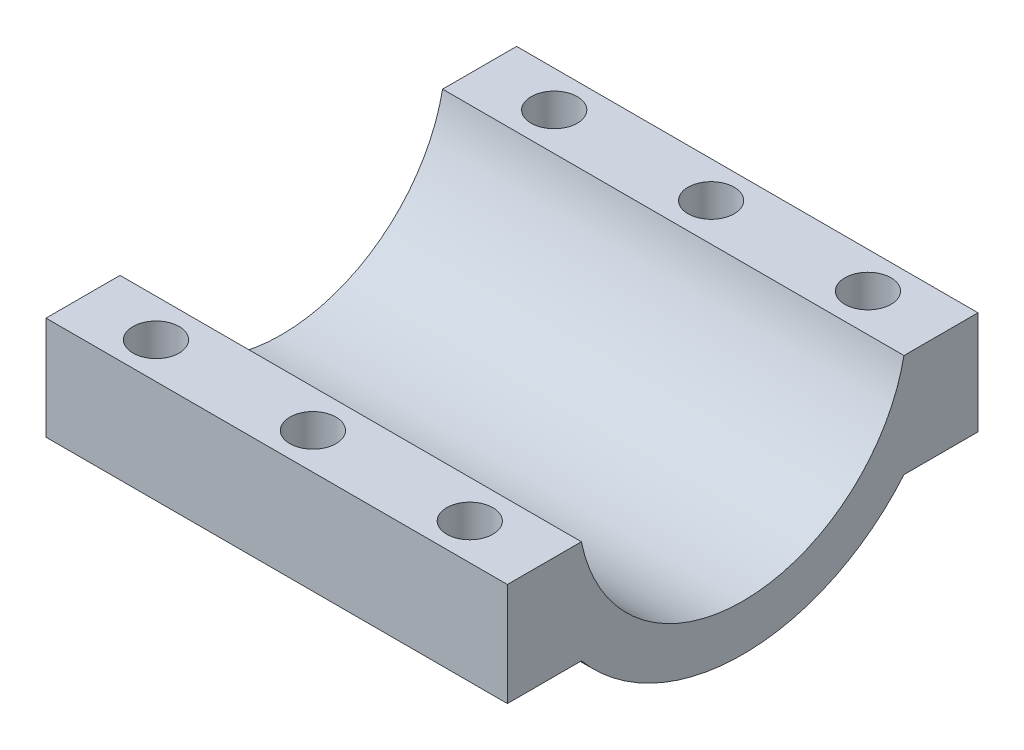
from build123d import *

# Parameters (mm, degrees)
SKETCH1_W           = 50
SKETCH1_H           = 51
SKETCH1_R           = 2.5
BOSS_EXTRUDE1_DEPTH = 19.325
SKETCH2_R           = 17.825
CUT_EXTRUDE1_DEPTH  = 60.36080883
SKETCH3_R           = 6
CUT_EXTRUDE2_DEPTH  = 10


with BuildPart() as part:
    # Sketch1 → Boss-Extrude1 (new body)
    with BuildSketch(Plane(origin=(0, 0, 0), x_dir=(1, 0, 0), z_dir=(0, 1, 0))):
        Rectangle(SKETCH1_W, SKETCH1_H)
        with Locations((-17, 21.575)):
            Circle(SKETCH1_R, mode=Mode.SUBTRACT)
        with Locations((17, 21.575)):
            Circle(SKETCH1_R, mode=Mode.SUBTRACT)
        with Locations((17, -21.575)):
            Circle(SKETCH1_R, mode=Mode.SUBTRACT)
        with Locations((-17, -21.575)):
            Circle(SKETCH1_R, mode=Mode.SUBTRACT)
        with Locations((0, 21.575)):
            Circle(SKETCH1_R, mode=Mode.SUBTRACT)
        with Locations((0, -21.575)):
            Circle(SKETCH1_R, mode=Mode.SUBTRACT)
    extrude(amount=BOSS_EXTRUDE1_DEPTH)

    # Sketch2 → Cut-Extrude1 (cut, through all)
    with BuildSketch(Plane(origin=(25, 0, 0), x_dir=(0, 0, -1), z_dir=(1, 0, 0))):
        with Locations((0, 22.825)):
            Circle(SKETCH2_R)
        with BuildLine():
            Line((-17.478004034, 8.145081744), (-25.5, 8.145081744))
            Line((-25.5, 8.145081744), (-25.5, -3.621808916))
            Line((-25.5, -3.621808916), (25.5, -3.621808916))
            Line((25.5, -3.621808916), (25.5, 8.145081744))
            Line((25.5, 8.145081744), (17.478004034, 8.145081744))
            ThreePointArc((17.478004034, 8.145081744), (0, 0), (-17.478004034, 8.145081744))
        make_face()
    extrude(amount=-CUT_EXTRUDE1_DEPTH, mode=Mode.SUBTRACT)

    # Sketch3 → Cut-Extrude2 (cut)
    with BuildSketch(Plane.XZ.offset(-8.145081744)):
        with Locations((-17, -21.575)):
            Circle(SKETCH3_R)
        with Locations((0, -21.575)):
            Circle(SKETCH3_R)
        with Locations((17, -21.575)):
            Circle(SKETCH3_R)
        with Locations((17, 21.575)):
            Circle(SKETCH3_R)
        with Locations((0, 21.575)):
            Circle(SKETCH3_R)
        with Locations((-17, 21.575)):
            Circle(SKETCH3_R)
    extrude(amount=CUT_EXTRUDE2_DEPTH, mode=Mode.SUBTRACT)


solid = part.part
